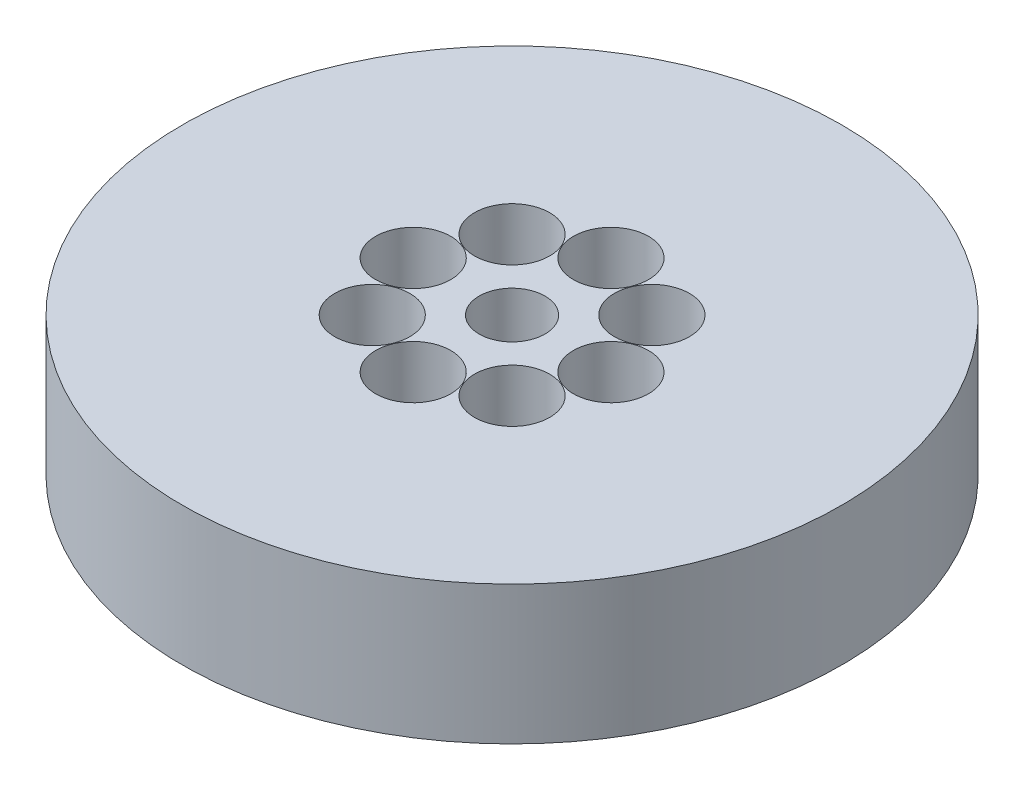
from build123d import *

# Parameters (mm, degrees)
SKETCH1_R           = 50
BOSS_EXTRUDE1_DEPTH = 21
SKETCH2_R           = 5
CUT_EXTRUDE1_DEPTH  = 74.763134424
SKETCH3_R           = 5.699457957
CUT_EXTRUDE2_DEPTH  = 20.526550641
CIRPATTERN1_COUNT   = 8


with BuildPart() as part:
    # Sketch1 → Boss-Extrude1 (new body)
    with BuildSketch(Plane(origin=(0, 0, 0), x_dir=(1, 0, 0), z_dir=(0, 1, 0))):
        Circle(SKETCH1_R)
    extrude(amount=BOSS_EXTRUDE1_DEPTH)

    # Sketch2 → Cut-Extrude1 (cut, through all)
    with BuildSketch(Plane(origin=(0, 0, 0), x_dir=(1, 0, 0), z_dir=(0, 1, 0))):
        Circle(SKETCH2_R)
    extrude(amount=CUT_EXTRUDE1_DEPTH, mode=Mode.SUBTRACT)

    # Sketch3 → Cut-Extrude2 (cut)
    with BuildSketch(Plane(origin=(0, 21, 0), x_dir=(1, 0, 0), z_dir=(0, 1, 0))):
        with Locations((-14.999639577, 0)):
            Circle(SKETCH3_R)
    cut_extrude2 = extrude(amount=-CUT_EXTRUDE2_DEPTH, mode=Mode.SUBTRACT)

    # CirPattern1: Cut-Extrude2 ×8 about axis
    cirpattern1_axis = Axis((0, 0, 0), (0, 1, 0))
    for i in range(1, CIRPATTERN1_COUNT):
        add(cut_extrude2.rotate(cirpattern1_axis, i * 360 / CIRPATTERN1_COUNT), mode=Mode.SUBTRACT)


solid = part.part
